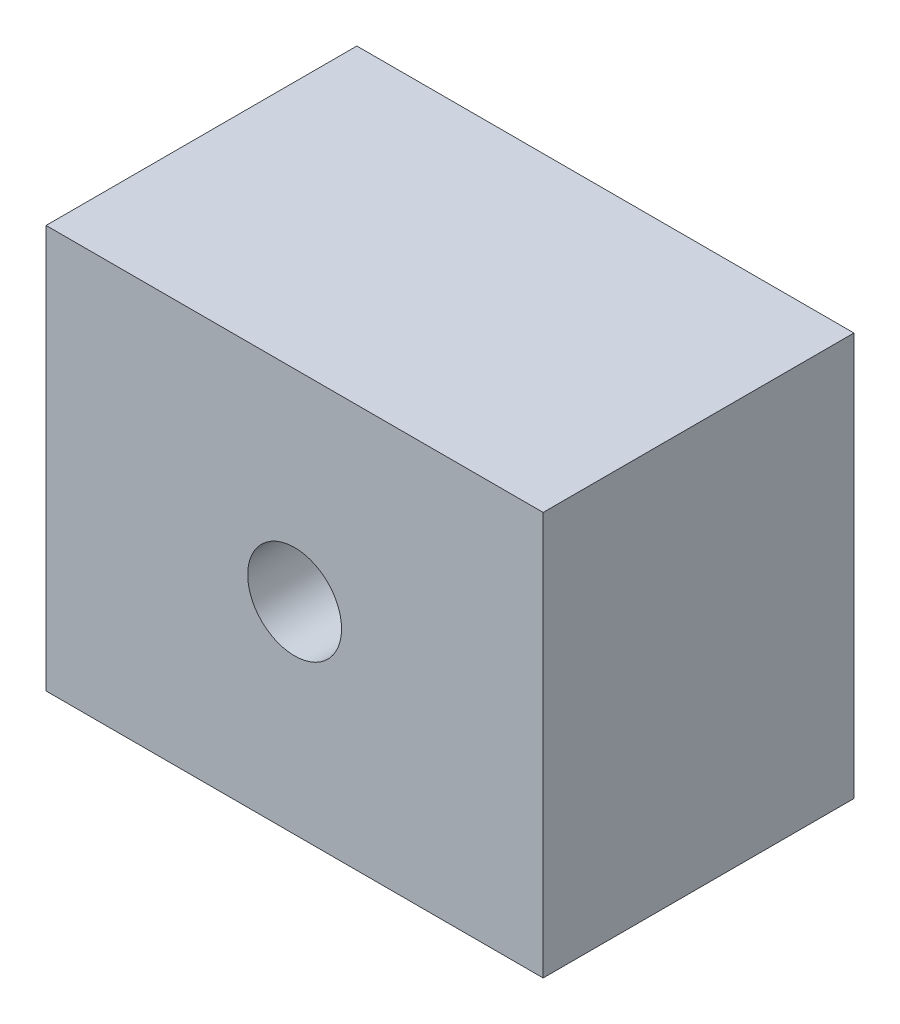
from build123d import *

# Parameters (mm, degrees)
SKETCH2_W           = 134.477697302
SKETCH2_H           = 109.076354478
BOSS_EXTRUDE1_DEPTH = 84.074
SKETCH3_R           = 12.7
CUT_EXTRUDE1_DEPTH  = 127


with BuildPart() as part:
    # Sketch2 → Boss-Extrude1 (new body)
    with BuildSketch(Plane.XY):
        Rectangle(SKETCH2_W, SKETCH2_H)
    extrude(amount=BOSS_EXTRUDE1_DEPTH)

    # Sketch3 → Cut-Extrude1 (cut)
    with BuildSketch(Plane.XY.offset(84.074)):
        Circle(SKETCH3_R)
    extrude(amount=-CUT_EXTRUDE1_DEPTH, mode=Mode.SUBTRACT)


solid = part.part
